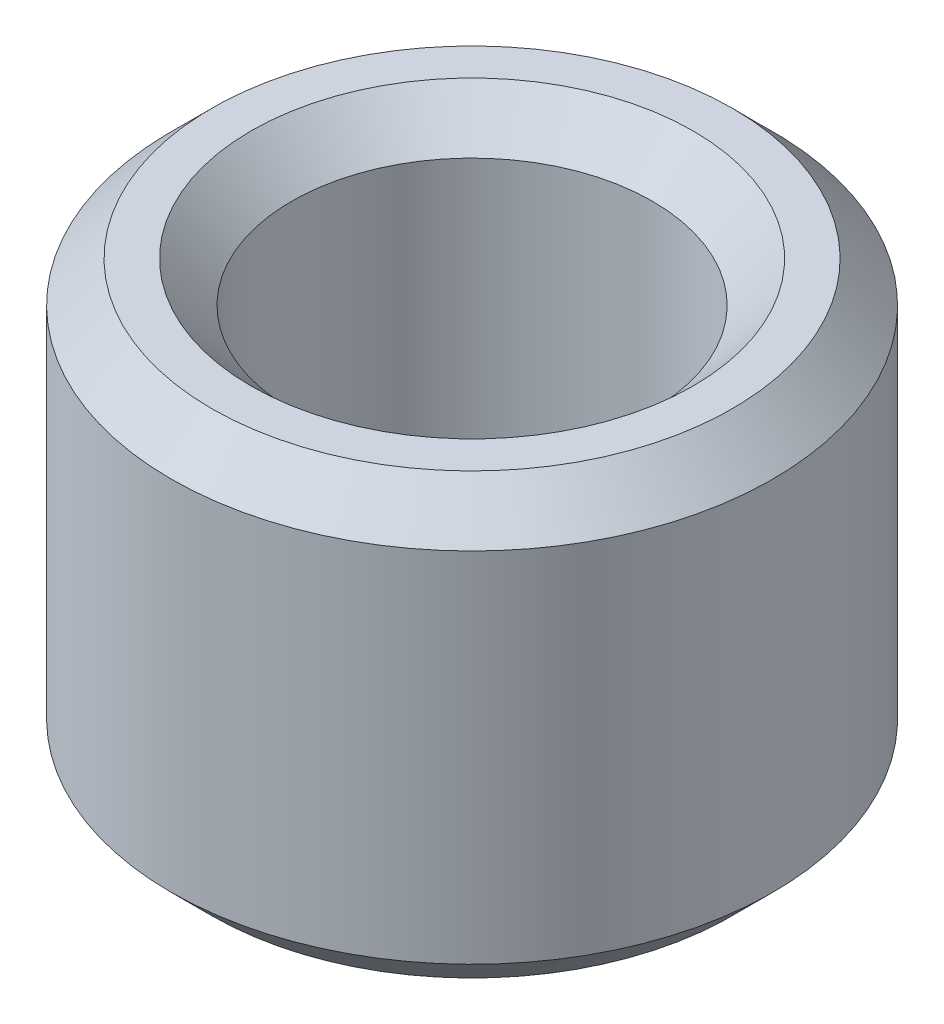
from build123d import *

# Parameters (mm, degrees)
SKETCH1_R           = 12.5
BOSS_EXTRUDE1_DEPTH = 18.244211611
SKETCH2_R           = 7.494935144
CUT_EXTRUDE1_DEPTH  = 26.403764628
CHAMFER1_SIZE       = 1.68741653


with BuildPart() as part:
    # Sketch1 → Boss-Extrude1 (new body)
    with BuildSketch(Plane(origin=(0, 0, 0), x_dir=(1, 0, 0), z_dir=(0, 1, 0))):
        Circle(SKETCH1_R)
    extrude(amount=BOSS_EXTRUDE1_DEPTH)

    # Sketch2 → Cut-Extrude1 (cut, through all)
    with BuildSketch(Plane(origin=(0, 0, 0), x_dir=(1, 0, 0), z_dir=(0, 1, 0))):
        Circle(SKETCH2_R)
    extrude(amount=CUT_EXTRUDE1_DEPTH, mode=Mode.SUBTRACT)

    # Chamfer1
    chamfer1_edges = [part.edges().sort_by_distance(p)[0] for p in [
        (-7.494935144, 18.244211611, 0),
        (-7.494935144, 0, 0),
        (-12.5, 0, 0),
        (-12.5, 18.244211611, 0),
    ]]
    chamfer(chamfer1_edges, length=CHAMFER1_SIZE)


solid = part.part
